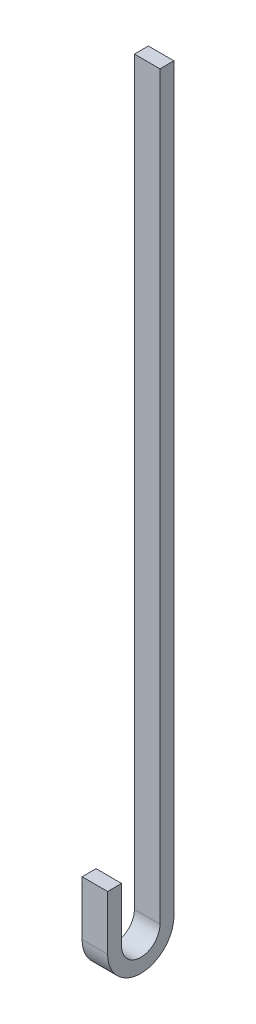
from build123d import *

# Parameters (mm, degrees)
BOSS_EXTRUDE1_DEPTH = 27.432


with BuildPart() as part:
    # Sketch1 → Boss-Extrude1 (new body)
    with BuildSketch(Plane(origin=(0, 0, 0), x_dir=(0, 0, -1), z_dir=(1, 0, 0))):
        with BuildLine():
            Line((0, 0), (0, -58.442482619))
            ThreePointArc((0, -58.442482619), (35.56, -94.002482619), (71.12, -58.442482619))
            Line((71.12, -58.442482619), (71.12, 736.6))
            Line((71.12, 736.6), (56.134, 736.6))
            Line((56.134, 736.6), (56.134, -58.442482619))
            ThreePointArc((56.134, -58.442482619), (35.56, -79.016482619), (14.986, -58.442482619))
            Line((14.986, -58.442482619), (14.986, 0))
            Line((14.986, 0), (0, 0))
        make_face()
    extrude(amount=BOSS_EXTRUDE1_DEPTH)


solid = part.part
